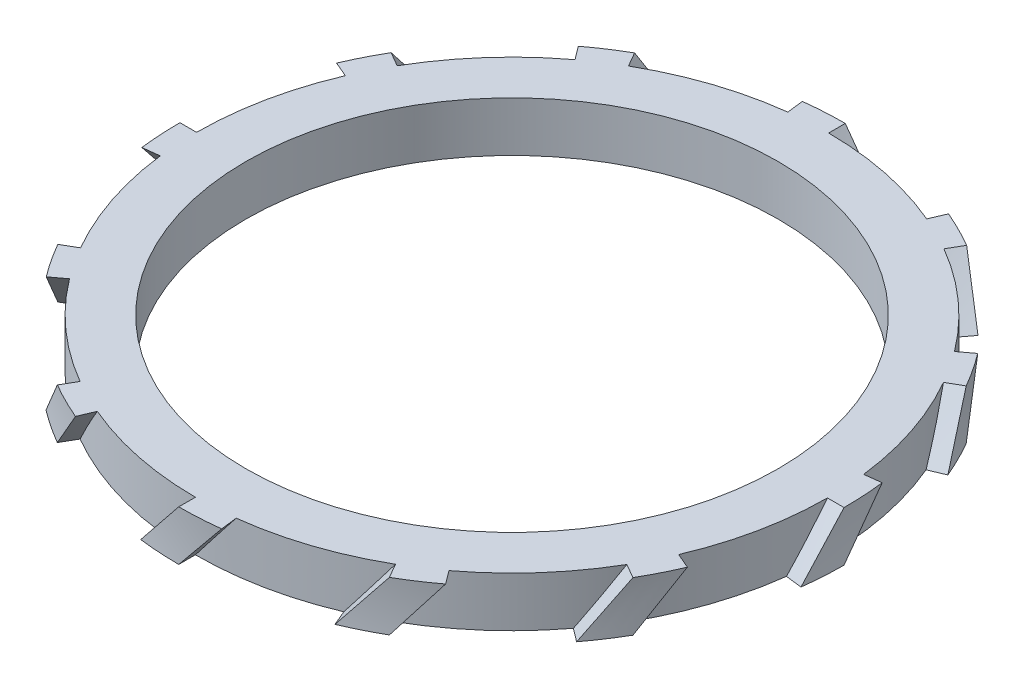
from build123d import *

# Parameters (mm, degrees)
SKETCH2_R           = 47.5
SKETCH2_R_2         = 40
BOSS_EXTRUDE2_DEPTH = 7.5
CIRPATTERN1_COUNT   = 12


with BuildPart() as part:
    # Sketch2 → Boss-Extrude2 (new body)
    with BuildSketch(Plane(origin=(0, 0, 0), x_dir=(1, 0, 0), z_dir=(0, 1, 0))):
        with Locations(Location((0, 0, 0), (0, 0, 270))):
            Circle(SKETCH2_R)
        with Locations(Location((0, 0, 0), (0, 0, 270))):
            Circle(SKETCH2_R_2, mode=Mode.SUBTRACT)
    extrude(amount=-BOSS_EXTRUDE2_DEPTH)

    # Loft2: read off the stored shape, not the designer's step
    # Loft2: loft between two sections, ruled curve by curve
    loft2_from = [
        Edge.make_bspline([(-5.700542846, 0, -47.156694236), (-5.750547608, 0, -47.570349449), (-5.80055237, 0, -47.984004661), (-5.900561893, 0, -48.811315086), (-5.950566655, 0, -49.224970299), (-6.000571417, 0, -49.638625511)], [0, 0, 0, 0, 0.5, 0.5, 1, 1, 1, 1], 3),
        Edge.make_bspline([(-6.000571417, 0, -49.638625511), (-3.977812454, 0, -49.88314698), (-1.943898665, 0, -50.003725887), (0.093582631, 0, -49.999912423)], [0, 0, 0, 0, 1, 1, 1, 1], 3, [1, 0.998756532, 0.998756532, 1]),
        Edge.make_bspline([(0.093582631, 0, -49.999912423), (0.092802776, 0, -49.583246486), (0.092022921, 0, -49.166580549), (0.09046321, 0, -48.333248675), (0.089683355, 0, -47.916582739), (0.088903499, 0, -47.499916802)], [0, 0, 0, 0, 0.5, 0.5, 1, 1, 1, 1], 3),
        Edge.make_line((0.088903499, 0, -47.499916802), (-5.700542846, 0, -47.156694236)),
    ]
    loft2_to = [
        Edge.make_bspline([(0.088903499, -7.5, -47.499916802), (0.089683355, -7.5, -47.916582739), (0.09046321, -7.5, -48.333248675), (0.092022921, -7.5, -49.166580549), (0.092802776, -7.5, -49.583246486), (0.093582631, -7.5, -49.999912423)], [0, 0, 0, 0, 0.5, 0.5, 1, 1, 1, 1], 3),
        Edge.make_bspline([(0.093582631, -7.5, -49.999912423), (2.131063927, -7.5, -49.996098959), (4.164512103, -7.5, -49.867907351), (6.186341578, -7.5, -49.615815804)], [0, 0, 0, 0, 1, 1, 1, 1], 3, [1, 0.998756532, 0.998756532, 1]),
        Edge.make_bspline([(6.186341578, -7.5, -49.615815804), (6.134788731, -7.5, -49.202350672), (6.083235885, -7.5, -48.78888554), (5.980130192, -7.5, -47.961955277), (5.928577345, -7.5, -47.548490145), (5.877024499, -7.5, -47.135025014)], [0, 0, 0, 0, 0.5, 0.5, 1, 1, 1, 1], 3),
        Edge.make_line((5.877024499, -7.5, -47.135025014), (0.088903499, -7.5, -47.499916802)),
    ]
    loft2 = Solid(Shell([*[Face.make_surface_from_curves(loft2_from[k], loft2_to[k]) for k in range(4)], Face(Wire(loft2_from)), Face(Wire(loft2_to))]))
    add(loft2)

    # CirPattern1: Loft2 ×12 about axis
    cirpattern1_axis = Axis((0, 0, 0), (0, 1, 0))
    for i in range(1, CIRPATTERN1_COUNT):
        add(loft2.rotate(cirpattern1_axis, i * 360 / CIRPATTERN1_COUNT))


solid = part.part
